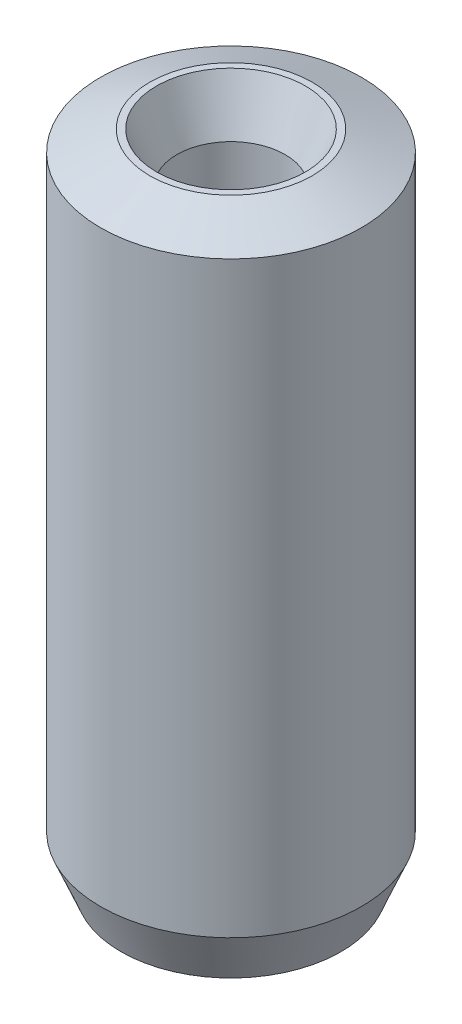
from build123d import *
from OCP.BRepFilletAPI import BRepFilletAPI_MakeChamfer

# Parameters (mm, degrees)
SKETCH1_R           = 15
BOSS_EXTRUDE1_DEPTH = 75.617741354
SKETCH2_R           = 6.228109707
CUT_EXTRUDE1_DEPTH  = 79.536888195
CHAMFER1_SIZE       = 2.340860205
CHAMFER1_SIZE2      = 5.664063025


with BuildPart() as part:
    # Sketch1 → Boss-Extrude1 (new body)
    with BuildSketch(Plane(origin=(0, 0, 0), x_dir=(1, 0, 0), z_dir=(0, 1, 0))):
        Circle(SKETCH1_R)
    extrude(amount=BOSS_EXTRUDE1_DEPTH)

    # Sketch2 → Cut-Extrude1 (cut, through all)
    with BuildSketch(Plane(origin=(0, 0, 0), x_dir=(1, 0, 0), z_dir=(0, 1, 0))):
        Circle(SKETCH2_R)
    extrude(amount=CUT_EXTRUDE1_DEPTH, mode=Mode.SUBTRACT)

    # Chamfer1: one chamfer whose edges measure the first distance from different faces: ONE call of the kernel's chamfer builder (chamfer() names one face for all edges)
    chamfer1_edges_1 = [part.edges().sort_by_distance(p)[0] for p in [
        (-6.228109707, 75.617741354, 0),
    ]]
    chamfer1_side_1 = [part.faces().sort_by_distance(p)[0] for p in [
        (-14.575735931, 75.617741354, 0),
    ]]
    chamfer1_edges_2 = [part.edges().sort_by_distance(p)[0] for p in [
        (-6.228109707, 0, 0),
    ]]
    chamfer1_side_2 = [part.faces().sort_by_distance(p)[0] for p in [
        (-6.228109707, 37.808870677, 0),
    ]]
    chamfer1_edges_3 = [part.edges().sort_by_distance(p)[0] for p in [
        (-15, 0, 0),
    ]]
    chamfer1_side_3 = [part.faces().sort_by_distance(p)[0] for p in [
        (-14.575735931, 0, 0),
    ]]
    chamfer1_edges_4 = [part.edges().sort_by_distance(p)[0] for p in [
        (-15, 75.617741354, 0),
    ]]
    chamfer1_side_4 = [part.faces().sort_by_distance(p)[0] for p in [
        (-15, 37.808870677, 0),
    ]]
    chamfer1 = BRepFilletAPI_MakeChamfer(part.part.solid().wrapped)
    for e in chamfer1_edges_1:
        chamfer1.Add(CHAMFER1_SIZE, CHAMFER1_SIZE2, e.wrapped, chamfer1_side_1[0].wrapped)  # the first distance lies on this face
    for e in chamfer1_edges_2:
        chamfer1.Add(CHAMFER1_SIZE, CHAMFER1_SIZE2, e.wrapped, chamfer1_side_2[0].wrapped)  # the first distance lies on this face
    for e in chamfer1_edges_3:
        chamfer1.Add(CHAMFER1_SIZE, CHAMFER1_SIZE2, e.wrapped, chamfer1_side_3[0].wrapped)  # the first distance lies on this face
    for e in chamfer1_edges_4:
        chamfer1.Add(CHAMFER1_SIZE, CHAMFER1_SIZE2, e.wrapped, chamfer1_side_4[0].wrapped)  # the first distance lies on this face
    add(Compound.cast(chamfer1.Shape()), mode=Mode.REPLACE)


solid = part.part
